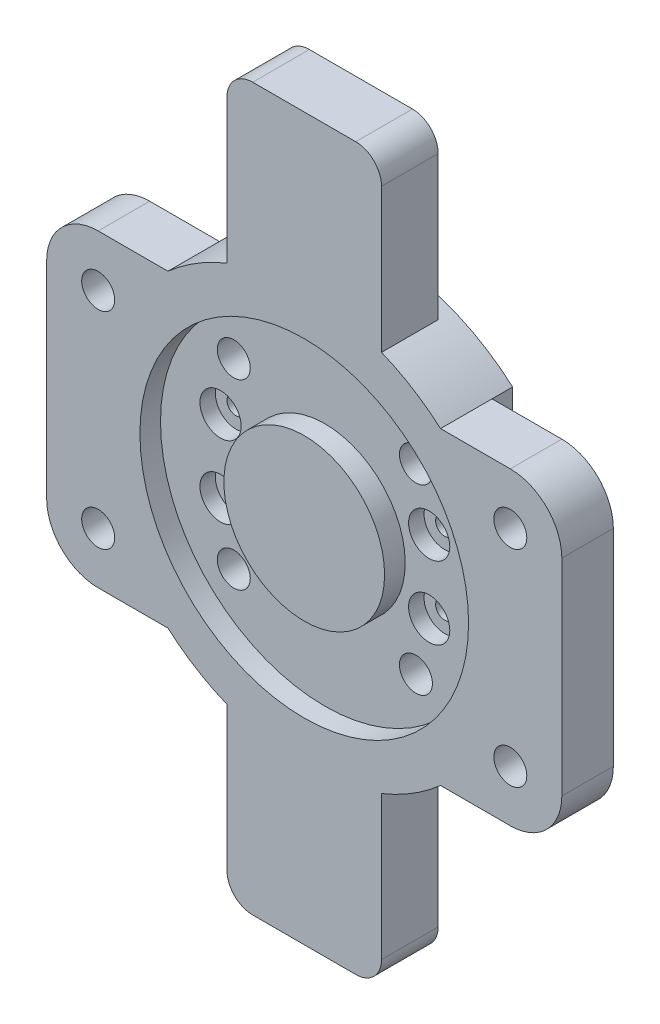
from build123d import *

# Parameters (mm, degrees)
SKETCH_1_R            = 40
EXTRUDE_1_DEPTH       = 10
OTHER_1_OUTLINE_R     = 2
OTHER_1_OUTLINE_R_2   = 1.41
OTHER_1_DEPTH         = 3
OTHER_START           = 2
OTHER_1_2_OUTLINE_R   = 1.41
OTHER_1_2_OUTLINE_R_2 = 1.05
OTHER_1_2_DEPTH       = 1
OTHER_1_3_OUTLINE_R   = 2
OTHER_1_3_OUTLINE_R_2 = 1
OTHER_1_3_DEPTH       = 2
OTHER_START_2         = -3.2
OTHER_1_4_DEPTH       = 6.4
CUT_EXTRUDE_START     = 20
CUT_EXTRUDE_1_DEPTH   = 20
MOVE_START            = -1
MOVE_FACE_3_DEPTH     = 4
SKETCH_3_W            = 12
SKETCH_3_H            = 26.95
CUT_EXTRUDE_3_DEPTH   = 3
FILLET_2_R            = 2
SKETCH_5_R            = 15.6
EXTRUDE_2_DEPTH       = 4
SKETCH_6_R            = 40
SKETCH_6_R_2          = 31.9
EXTRUDE_3_DEPTH       = 4
SKETCH_7_R            = 3.2
CUT_EXTRUDE_5_DEPTH   = 54
SKETCH_9_R            = 1.75
CUT_EXTRUDE_7_DEPTH   = 54
SKETCH_10_R           = 4
CUT_EXTRUDE_8_DEPTH   = 3
EXTRUDE_START         = -10
SKETCH_13_R           = 3.2
EXTRUDE_5_DEPTH       = 10
CUT_EXTRUDE_START_2   = 28
CUT_EXTRUDE_11_DEPTH  = 28
FILLET_3_R            = 10
EXTRUDE_START_2       = -11
EXTRUDE_7_DEPTH       = 11
FILLET_4_R            = 5
SKETCH_17_R           = 1.1
CUT_EXTRUDE_12_DEPTH  = 8


with BuildPart() as part:
    # 草图1 → 凸台-拉伸1 (new body)
    with BuildSketch(Plane.XY):
        Circle(SKETCH_1_R)
    extrude(amount=EXTRUDE_1_DEPTH)

    # 型腔1: read off the stored shape, not the designer's step
    # 型腔1 outline → 型腔1 (cut)
    with BuildSketch(Plane.XY):
        with BuildLine():
            Line((3.2, 12.75), (3.2, 7.95))
            ThreePointArc((3.2, 7.95), (3.317157288, 7.667157288), (3.6, 7.55))
            Line((3.6, 7.55), (4.35, 7.55))
            Line((4.35, 7.55), (4.35, -4.35))
            Line((4.35, -4.35), (-4.35, -4.35))
            Line((-4.35, -4.35), (-4.35, 7.55))
            Line((-4.35, 7.55), (-3.6, 7.55))
            ThreePointArc((-3.6, 7.55), (-3.317157288, 7.667157288), (-3.2, 7.95))
            Line((-3.2, 7.95), (-3.2, 12.75))
            Line((-3.2, 12.75), (-14.25, 12.75))
            ThreePointArc((-14.25, 12.75), (-15.664213562, 12.164213562), (-16.25, 10.75))
            Line((-16.25, 10.75), (-16.25, -10.75))
            ThreePointArc((-16.25, -10.75), (-15.664213562, -12.164213562), (-14.25, -12.75))
            Line((-14.25, -12.75), (14.25, -12.75))
            ThreePointArc((14.25, -12.75), (15.664213562, -12.164213562), (16.25, -10.75))
            Line((16.25, -10.75), (16.25, 10.75))
            ThreePointArc((16.25, 10.75), (15.664213562, 12.164213562), (14.25, 12.75))
            Line((14.25, 12.75), (3.2, 12.75))
        make_face()
        with Locations((-13.5, -10)):
            Circle(OTHER_1_OUTLINE_R, mode=Mode.SUBTRACT)
        with Locations((-8.5, -7.75)):
            Circle(OTHER_1_OUTLINE_R_2, mode=Mode.SUBTRACT)
        with Locations((13.5, -10)):
            Circle(OTHER_1_OUTLINE_R, mode=Mode.SUBTRACT)
        with Locations((8.5, -7.75)):
            Circle(OTHER_1_OUTLINE_R_2, mode=Mode.SUBTRACT)
        with Locations((-8.5, 7.75)):
            Circle(OTHER_1_OUTLINE_R_2, mode=Mode.SUBTRACT)
        with Locations((-13.5, 10)):
            Circle(OTHER_1_OUTLINE_R, mode=Mode.SUBTRACT)
        with Locations((8.5, 7.75)):
            Circle(OTHER_1_OUTLINE_R_2, mode=Mode.SUBTRACT)
        with Locations((13.5, 10)):
            Circle(OTHER_1_OUTLINE_R, mode=Mode.SUBTRACT)
    extrude(amount=OTHER_1_DEPTH, mode=Mode.SUBTRACT)

    # Other 1 2 outline → Other 1 2 (cut)
    # profile 1 of 5: a face of its own
    with BuildSketch(Plane.XY.offset(OTHER_START)):
        with Locations((8.5, -7.75)):
            Circle(OTHER_1_2_OUTLINE_R)
        with Locations((8.5, -7.75)):
            Circle(OTHER_1_2_OUTLINE_R_2, mode=Mode.SUBTRACT)
    # profile 2 of 5: a face of its own
    with BuildSketch(Plane.XY.offset(OTHER_START)):
        with Locations((-8.5, -7.75)):
            Circle(OTHER_1_2_OUTLINE_R)
        with Locations((-8.5, -7.75)):
            Circle(OTHER_1_2_OUTLINE_R_2, mode=Mode.SUBTRACT)
    # profile 3 of 5: a face of its own
    with BuildSketch(Plane.XY.offset(OTHER_START)):
        with Locations((-8.5, 7.75)):
            Circle(OTHER_1_2_OUTLINE_R)
        with Locations((-8.5, 7.75)):
            Circle(OTHER_1_2_OUTLINE_R_2, mode=Mode.SUBTRACT)
    # profile 4 of 5: a face of its own
    with BuildSketch(Plane.XY.offset(OTHER_START)):
        with Locations((8.5, 7.75)):
            Circle(OTHER_1_2_OUTLINE_R)
        with Locations((8.5, 7.75)):
            Circle(OTHER_1_2_OUTLINE_R_2, mode=Mode.SUBTRACT)
    # profile 5 of 5: a face of its own
    with BuildSketch(Plane.XY.offset(OTHER_START)):
        with BuildLine():
            ThreePointArc((3.6, 7.55), (3.317157288, 7.667157288), (3.2, 7.95))
            Line((3.2, 7.95), (3.2, 12.75))
            Line((3.2, 12.75), (-3.2, 12.75))
            Line((-3.2, 12.75), (-3.2, 7.95))
            ThreePointArc((-3.2, 7.95), (-3.317157288, 7.667157288), (-3.6, 7.55))
            Line((-3.6, 7.55), (-4.35, 7.55))
            Line((-4.35, 7.55), (-4.35, -4.35))
            Line((-4.35, -4.35), (4.35, -4.35))
            Line((4.35, -4.35), (4.35, 7.55))
            Line((4.35, 7.55), (3.6, 7.55))
        make_face()
    extrude(amount=OTHER_1_2_DEPTH, mode=Mode.SUBTRACT)

    # Other 1 3 outline → Other 1 3 (cut)
    # profile 1 of 4: a face of its own
    with BuildSketch(Plane.XY):
        with Locations((13.5, 10)):
            Circle(OTHER_1_3_OUTLINE_R)
        with Locations((13.5, 10)):
            Circle(OTHER_1_3_OUTLINE_R_2, mode=Mode.SUBTRACT)
    # profile 2 of 4: a face of its own
    with BuildSketch(Plane.XY):
        with Locations((-13.5, 10)):
            Circle(OTHER_1_3_OUTLINE_R)
        with Locations((-13.5, 10)):
            Circle(OTHER_1_3_OUTLINE_R_2, mode=Mode.SUBTRACT)
    # profile 3 of 4: a face of its own
    with BuildSketch(Plane.XY):
        with Locations((-13.5, -10)):
            Circle(OTHER_1_3_OUTLINE_R)
        with Locations((-13.5, -10)):
            Circle(OTHER_1_3_OUTLINE_R_2, mode=Mode.SUBTRACT)
    # profile 4 of 4: a face of its own
    with BuildSketch(Plane.XY):
        with Locations((13.5, -10)):
            Circle(OTHER_1_3_OUTLINE_R)
        with Locations((13.5, -10)):
            Circle(OTHER_1_3_OUTLINE_R_2, mode=Mode.SUBTRACT)
    extrude(amount=OTHER_1_3_DEPTH, mode=Mode.SUBTRACT)

    # Other 1 4 outline → Other 1 4 (cut)
    with BuildSketch(Plane.YZ.offset(OTHER_START_2)):
        with BuildLine():
            Line((12.75, 0.4), (12.75, 2))
            Line((12.75, 2), (9.16479448, 2))
            ThreePointArc((9.16479448, 2), (9.726450246, 1.919516294), (10.242901873, 1.684542801))
            Line((10.242901873, 1.684542801), (12.003549064, 0.557728599))
            ThreePointArc((12.003549064, 0.557728599), (12.261774878, 0.440241853), (12.54260276, 0.4))
            Line((12.54260276, 0.4), (12.75, 0.4))
        make_face()
    extrude(amount=OTHER_1_4_DEPTH, mode=Mode.SUBTRACT)

    # 草图2 → 切除-拉伸1 (cut)
    with BuildSketch(Plane(origin=(0, 0, 3), x_dir=(-1, 0, 0), z_dir=(0, 0, -1)).offset(CUT_EXTRUDE_START)):
        with BuildLine():
            Line((16.25, -10.75), (16.25, 10.75))
            ThreePointArc((16.25, 10.75), (15.664213562, 12.164213562), (14.25, 12.75))
            Line((14.25, 12.75), (-14.25, 12.75))
            ThreePointArc((-14.25, 12.75), (-15.664213562, 12.164213562), (-16.25, 10.75))
            Line((-16.25, 10.75), (-16.25, -10.75))
            ThreePointArc((-16.25, -10.75), (-15.664213562, -12.164213562), (-14.25, -12.75))
            Line((-14.25, -12.75), (14.25, -12.75))
            ThreePointArc((14.25, -12.75), (15.664213562, -12.164213562), (16.25, -10.75))
        make_face()
    extrude(amount=-CUT_EXTRUDE_1_DEPTH, mode=Mode.SUBTRACT)

    # Move Face 3: read off the stored shape, not the designer's step
    # Move Face 3 outline → Move Face 3 (cut)
    with BuildSketch(Plane.XY.offset(MOVE_START)):
        with BuildLine():
            Line((16.55, -10.75), (16.55, 10.75))
            ThreePointArc((16.55, 10.75), (15.876345597, 12.376345597), (14.25, 13.05))
            Line((14.25, 13.05), (-14.25, 13.05))
            ThreePointArc((-14.25, 13.05), (-15.876345597, 12.376345597), (-16.55, 10.75))
            Line((-16.55, 10.75), (-16.55, -10.75))
            ThreePointArc((-16.55, -10.75), (-15.876345597, -12.376345597), (-14.25, -13.05))
            Line((-14.25, -13.05), (14.25, -13.05))
            ThreePointArc((14.25, -13.05), (15.876345597, -12.376345597), (16.55, -10.75))
        make_face()
        with BuildLine():
            ThreePointArc((14.25, 12.75), (15.664213562, 12.164213562), (16.25, 10.75))
            Line((16.25, 10.75), (16.25, -10.75))
            ThreePointArc((16.25, -10.75), (15.664213562, -12.164213562), (14.25, -12.75))
            Line((14.25, -12.75), (-14.25, -12.75))
            ThreePointArc((-14.25, -12.75), (-15.664213562, -12.164213562), (-16.25, -10.75))
            Line((-16.25, -10.75), (-16.25, 10.75))
            ThreePointArc((-16.25, 10.75), (-15.664213562, 12.164213562), (-14.25, 12.75))
            Line((-14.25, 12.75), (14.25, 12.75))
        make_face(mode=Mode.SUBTRACT)
    extrude(amount=MOVE_FACE_3_DEPTH, mode=Mode.SUBTRACT)

    # 草图3 → 切除-拉伸3 (cut)
    with BuildSketch(Plane(origin=(0, 0, 0), x_dir=(-1, 0, 0), z_dir=(0, 0, -1))):
        with Locations((0, -26.525)):
            Rectangle(SKETCH_3_W, SKETCH_3_H)
    extrude(amount=-CUT_EXTRUDE_3_DEPTH, mode=Mode.SUBTRACT)

    # 圆角2
    fillet_2_edges = [part.edges().sort_by_distance(p)[0] for p in [
        (-6, -39.547439867, 1.5),
        (-6, -13.05, 1.5),
        (6, -39.547439867, 1.5),
        (6, -13.05, 1.5),
    ]]
    fillet(fillet_2_edges, radius=FILLET_2_R)

    # 草图5 → 凸台-拉伸2 (add)
    with BuildSketch(Plane.XY.offset(10)):
        Circle(SKETCH_5_R)
    extrude(amount=EXTRUDE_2_DEPTH)

    # 草图6 → 凸台-拉伸3 (add)
    with BuildSketch(Plane.XY.offset(10)):
        with Locations(Location((0, 0, 0), (0, 0, 257.846802531))):
            Circle(SKETCH_6_R)
        Circle(SKETCH_6_R_2, mode=Mode.SUBTRACT)
    extrude(amount=EXTRUDE_3_DEPTH)

    # 草图7 → 切除-拉伸5 (cut)
    with BuildSketch(Plane.XY.offset(10)):
        with Locations((17.67766953, 17.67766953)):
            Circle(SKETCH_7_R)
        with Locations((17.67766953, -17.67766953)):
            Circle(SKETCH_7_R)
        with Locations((-17.67766953, -17.67766953)):
            Circle(SKETCH_7_R)
        with Locations((-17.67766953, 17.67766953)):
            Circle(SKETCH_7_R)
    extrude(amount=-CUT_EXTRUDE_5_DEPTH, mode=Mode.SUBTRACT)

    # 草图9 → 切除-拉伸7 (cut)
    with BuildSketch(Plane(origin=(0, 0, 0), x_dir=(-1, 0, 0), z_dir=(0, 0, -1))):
        with Locations((20.25, 7.05)):
            Circle(SKETCH_9_R)
        with Locations(Location((20.25, -7.05, 0), (0, 0, 180))):
            Circle(SKETCH_9_R)
        with Locations((-20.25, -7.05)):
            Circle(SKETCH_9_R)
        with Locations(Location((-20.25, 7.05, 0), (0, 0, 180))):
            Circle(SKETCH_9_R)
    extrude(amount=-CUT_EXTRUDE_7_DEPTH, mode=Mode.SUBTRACT)

    # 草图10 → 切除-拉伸8 (cut)
    with BuildSketch(Plane.XY.offset(10)):
        with Locations((20.25, 7.05)):
            Circle(SKETCH_10_R)
        with Locations((20.25, -7.05)):
            Circle(SKETCH_10_R)
        with Locations((-20.25, 7.05)):
            Circle(SKETCH_10_R)
        with Locations((-20.25, -7.05)):
            Circle(SKETCH_10_R)
    extrude(amount=-CUT_EXTRUDE_8_DEPTH, mode=Mode.SUBTRACT)

    # 草图13 → 凸台-拉伸5 (add)
    # profile 1 of 2: a face of its own
    with BuildSketch(Plane.XY.offset(14).offset(EXTRUDE_START)):
        with BuildLine():
            Line((-50, 30), (-50, 0))
            Line((-50, 0), (-50, -30))
            Line((-50, -30), (-26.457513111, -30))
            ThreePointArc((-26.457513111, -30), (-40, 0), (-26.457513111, 30))
            Line((-26.457513111, 30), (-50, 30))
        make_face()
        with Locations((-40, -20)):
            Circle(SKETCH_13_R, mode=Mode.SUBTRACT)
        with Locations((-40, 20)):
            Circle(SKETCH_13_R, mode=Mode.SUBTRACT)
    # profile 2 of 2: a face of its own
    with BuildSketch(Plane.XY.offset(14).offset(EXTRUDE_START)):
        with BuildLine():
            Line((50, 30), (26.457513111, 30))
            ThreePointArc((26.457513111, 30), (36.457513111, 16.457513111), (40, 0))
            ThreePointArc((40, 0), (36.457513111, -16.457513111), (26.457513111, -30))
            Line((26.457513111, -30), (50, -30))
            Line((50, -30), (50, 30))
        make_face()
        with Locations((40, -20)):
            Circle(SKETCH_13_R, mode=Mode.SUBTRACT)
        with Locations((40, 20)):
            Circle(SKETCH_13_R, mode=Mode.SUBTRACT)
    extrude(amount=EXTRUDE_5_DEPTH)

    # 草图14 → 切除-拉伸11 (cut)
    with BuildSketch(Plane(origin=(0, 0, 4), x_dir=(-1, 0, 0), z_dir=(0, 0, -1)).offset(CUT_EXTRUDE_START_2)):
        with BuildLine():
            Line((-26.457513111, 30), (-26.457513111, -30))
            ThreePointArc((-26.457513111, -30), (-40, 0), (-26.457513111, 30))
        make_face()
        with BuildLine():
            Line((26.457513111, 30), (26.457513111, -30))
            ThreePointArc((26.457513111, -30), (40, 0), (26.457513111, 30))
        make_face()
    extrude(amount=-CUT_EXTRUDE_11_DEPTH, mode=Mode.SUBTRACT)

    # 圆角3
    fillet_3_edges = [part.edges().sort_by_distance(p)[0] for p in [
        (-50, 30, 9),
        (-50, -30, 9),
        (50, -30, 9),
        (50, 30, 9),
    ]]
    fillet(fillet_3_edges, radius=FILLET_3_R)

    # 草图16 → 凸台-拉伸7 (add)
    with BuildSketch(Plane.XY.offset(14).offset(EXTRUDE_START_2)):
        with BuildLine():
            Line((0, -70), (-15, -70))
            Line((-15, -70), (-15, -37.080992435))
            ThreePointArc((-15, -37.080992435), (0, -40), (15, -37.080992435))
            Line((15, -37.080992435), (15, -70))
            Line((15, -70), (0, -70))
        make_face()
        with BuildLine():
            Line((0, 70), (15, 70))
            Line((15, 70), (15, 37.080992435))
            ThreePointArc((15, 37.080992435), (0, 40), (-15, 37.080992435))
            Line((-15, 37.080992435), (-15, 70))
            Line((-15, 70), (0, 70))
        make_face()
    extrude(amount=EXTRUDE_7_DEPTH)

    # 圆角4
    fillet_4_edges = [part.edges().sort_by_distance(p)[0] for p in [
        (15, -70, 8.5),
        (-15, -70, 8.5),
        (-15, 70, 8.5),
        (15, 70, 8.5),
    ]]
    fillet(fillet_4_edges, radius=FILLET_4_R)

    # 草图17 → 切除-拉伸12 (cut)
    with BuildSketch(Plane(origin=(0, 0, 3), x_dir=(-1, 0, 0), z_dir=(0, 0, -1))):
        with Locations(Location((11, -65, 0), (0, 0, 180))):
            Circle(SKETCH_17_R)
        with Locations((-11, -56.1)):
            Circle(SKETCH_17_R)
    extrude(amount=-CUT_EXTRUDE_12_DEPTH, mode=Mode.SUBTRACT)


solid = part.part
